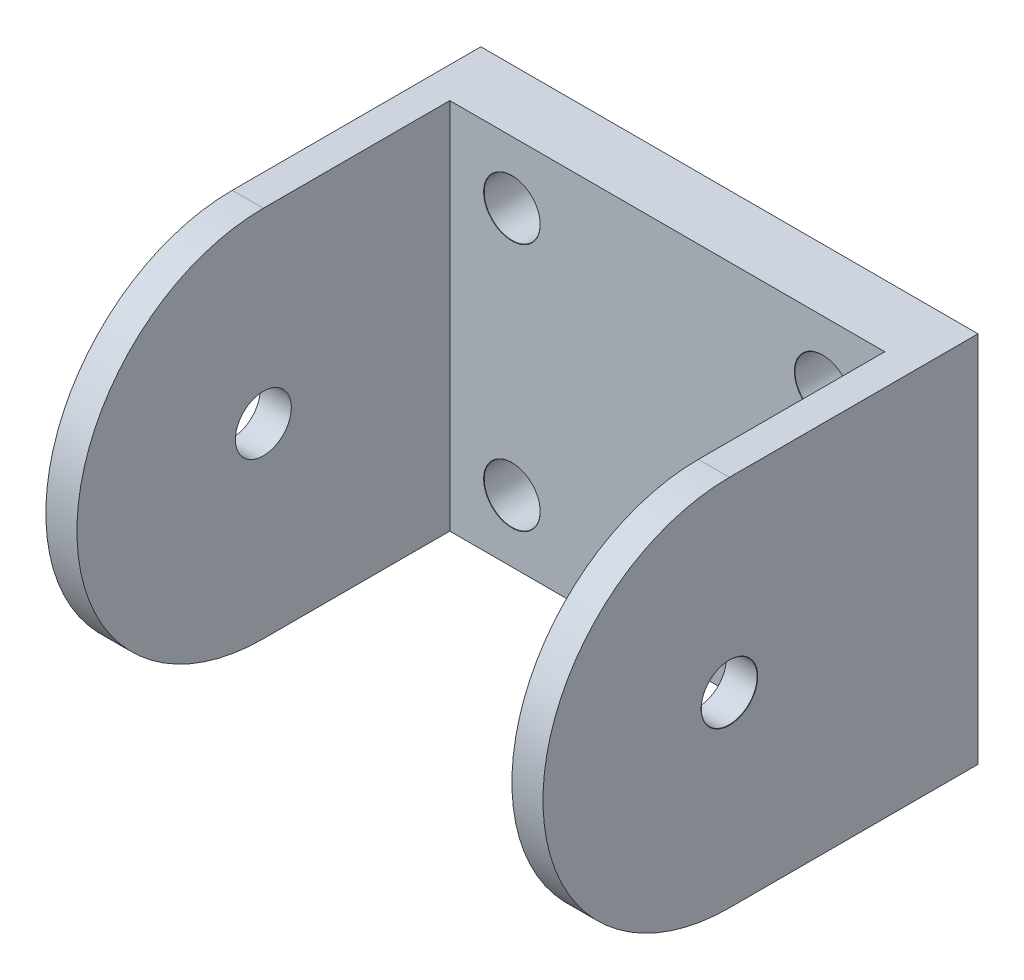
from build123d import *

# Parameters (mm, degrees)
SKETCH1_W                      = 40
SKETCH1_H                      = 30
BOSS_EXTRUDE1_DEPTH            = 5
BOSS_EXTRUDE2_DEPTH            = 2.5
M4_CLEARANCE_HOLE2_D           = 4.5
M4_CLEARANCE_HOLE2_CSINK_D     = 4.55
M4_CLEARANCE_HOLE2_CSINK_ANGLE = 100


# Read off the part's stored shape, not the designer's step: M4 Clearance Hole1
with BuildPart() as part:
    # Sketch1 → Boss-Extrude1 (new body)
    with BuildSketch(Plane.XY):
        Rectangle(SKETCH1_W, SKETCH1_H)
    extrude(amount=BOSS_EXTRUDE1_DEPTH)

    # Sketch2 → Boss-Extrude2 (add)
    with BuildSketch(Plane(origin=(20, 0, 0), x_dir=(0, 0, -1), z_dir=(1, 0, 0))):
        with BuildLine():
            Line((-5, -15), (-5, 15))
            Line((-5, 15), (-20, 15))
            ThreePointArc((-20, 15), (-35, 0), (-20, -15))
            Line((-20, -15), (-5, -15))
        make_face()
    boss_extrude2 = extrude(amount=-BOSS_EXTRUDE2_DEPTH)

    # Mirror1: Boss-Extrude2 across plane
    add(boss_extrude2.mirror(Plane(origin=(0, 0, 0), x_dir=(0, 0, 1), z_dir=(1, 0, 0))))

    # M4 Clearance Hole1 outline → M4 Clearance Hole1 (revolve, cut)
    with BuildSketch(Plane(origin=(12.5, 10, 0), x_dir=(1, 0, 0), z_dir=(0, -1, 0))):
        Polygon((0, 0), (2.25, 0), (2.25, 4.979022509), (2.275, 5), (0, 5), align=None)
    revolve(axis=Axis((12.5, 10, 0), (0, 0, 1)), mode=Mode.SUBTRACT)

    # M4 Clearance Hole1 2 outline → M4 Clearance Hole1 2 (revolve, cut)
    with BuildSketch(Plane(origin=(-12.5, -10, 0), x_dir=(1, 0, 0), z_dir=(0, -1, 0))):
        Polygon((0, 0), (2.25, 0), (2.25, 4.979022509), (2.275, 5), (0, 5), align=None)
    revolve(axis=Axis((-12.5, -10, 0), (0, 0, 1)), mode=Mode.SUBTRACT)

    # M4 Clearance Hole1 3 outline → M4 Clearance Hole1 3 (revolve, cut)
    with BuildSketch(Plane(origin=(12.5, -10, 0), x_dir=(1, 0, 0), z_dir=(0, -1, 0))):
        Polygon((0, 0), (2.25, 0), (2.25, 4.979022509), (2.275, 5), (0, 5), align=None)
    revolve(axis=Axis((12.5, -10, 0), (0, 0, 1)), mode=Mode.SUBTRACT)

    # M4 Clearance Hole1 4 outline → M4 Clearance Hole1 4 (revolve, cut)
    with BuildSketch(Plane(origin=(-12.5, 10, 0), x_dir=(1, 0, 0), z_dir=(0, -1, 0))):
        Polygon((0, 0), (2.25, 0), (2.25, 4.979022509), (2.275, 5), (0, 5), align=None)
    revolve(axis=Axis((-12.5, 10, 0), (0, 0, 1)), mode=Mode.SUBTRACT)

    # M4 Clearance Hole2 (through all)
    with Locations(Plane(origin=(20, 0, 0), x_dir=(0, 0, -1), z_dir=(1, 0, 0))):
        with Locations((-20, 0)):
            CounterSinkHole(M4_CLEARANCE_HOLE2_D / 2, M4_CLEARANCE_HOLE2_CSINK_D / 2, counter_sink_angle=M4_CLEARANCE_HOLE2_CSINK_ANGLE)


solid = part.part
